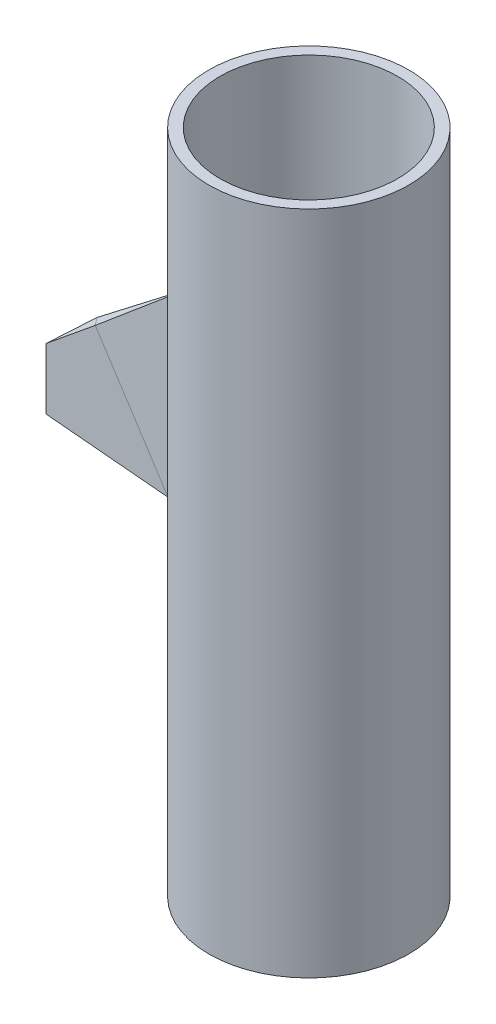
from build123d import *

# Parameters (mm, degrees)
SKETCH5_R           = 45
SKETCH5_R_2         = 40
BOSS_EXTRUDE6_DEPTH = 300
BOSS_EXTRUDE7_DEPTH = 5
SKETCH7_OUTSIDE_W   = 162.654
SKETCH7_OUTSIDE_H   = 372.654
CUT_EXTRUDE2_DEPTH  = 60
SKETCH8_OUTSIDE_W   = 236.044
SKETCH8_OUTSIDE_H   = 162.654
CUT_EXTRUDE4_DEPTH  = 63.333333
SKETCH9_R           = 2
CUT_EXTRUDE5_DEPTH  = 10


with BuildPart() as part:
    # Sketch5 → Boss-Extrude6 (new body)
    with BuildSketch(Plane(origin=(0, 0, 0), x_dir=(1, 0, 0), z_dir=(0, 1, 0))):
        with Locations(Location((0, 0, 0), (0, 0, 270))):
            Circle(SKETCH5_R)
        with Locations(Location((0, 0, 0), (0, 0, 270))):
            Circle(SKETCH5_R_2, mode=Mode.SUBTRACT)
    extrude(amount=BOSS_EXTRUDE6_DEPTH)


with BuildPart() as body_2:
    # Sketch6 → Boss-Extrude7 (new, symmetric)
    with BuildSketch(Plane.XY):
        Polygon((-58.389869674, 209.010177568), (-58.389869674, 129.010177568), (-118.389869674, 129.010177568), (-118.389869674, 159.010177568), align=None)
    extrude(amount=BOSS_EXTRUDE7_DEPTH, both=True)

    # Sketch7 outside → Cut-Extrude2 (cut)
    with BuildSketch(Plane(origin=(-58.389869674, 0, 0), x_dir=(0, 0, -1), z_dir=(1, 0, 0))):
        with Locations((0, 150)):
            Rectangle(SKETCH7_OUTSIDE_W, SKETCH7_OUTSIDE_H)
        Polygon((-5, 129.010177568), (0, 209.010177568), (5, 129.010177568), align=None, mode=Mode.SUBTRACT)
    extrude(amount=-CUT_EXTRUDE2_DEPTH, mode=Mode.SUBTRACT)

    # Sketch8 outside → Cut-Extrude4 (cut)
    with BuildSketch(Plane.XZ.offset(-129.010177568)):
        with Locations((-36.695, 0)):
            Rectangle(SKETCH8_OUTSIDE_W, SKETCH8_OUTSIDE_H)
        Polygon((-58.389869674, 5), (-118.389869674, 0), (-58.389869674, -5), align=None, mode=Mode.SUBTRACT)
    extrude(amount=-CUT_EXTRUDE4_DEPTH, mode=Mode.SUBTRACT)

    # Chamfer1
    # the kernel refuses this chamfer: 2 mm, written as the material it takes off along each edge
    with BuildSketch(Plane(origin=(-54.61893677, 212.152621655, 0.196402755), x_dir=(0.6406678172597216, -0.7640577696348805, -0.07589777722855967), z_dir=(-0.7676070857324205, -0.6396725714436841, -0.03997953571523024))) as chamfer1_piece_1:
        with BuildLine():
            Line((1.965032879, 0), (-0.204239114, 1.954390084))
            Line((-0.204239114, 1.954390084), (-0.244123554, 1.951351743))
            ThreePointArc((-0.244123554, 1.951351743), (-0.114485472, 0.976253024), (-0.039884439, -0.00303834))
            Line((-0.039884439, -0.00303834), (0.001123574, -0.039984217))
            ThreePointArc((0.001123574, -0.039984217), (0.982864796, -0.01239685), (1.966156453, -0.039984217))
            Line((1.966156453, -0.039984217), (1.965032879, 0))
        make_face()
    extrude(amount=57.926696558, mode=Mode.SUBTRACT)
    with BuildSketch(Plane(origin=(-99.083879501, 175.098502712, 2.119479678), x_dir=(-0.04868338001269826, -0.004005333382546194, -0.9988062303645456), z_dir=(0.7676070857324205, 0.6396725714436841, -0.03997953571523024))) as chamfer1_piece_2:
        with BuildLine():
            Line((1.965032879, 0), (-0.204239114, -1.954390084))
            Line((-0.204239114, -1.954390084), (-0.244123554, -1.951351743))
            ThreePointArc((-0.244123554, -1.951351743), (-0.114485472, -0.976253024), (-0.039884439, 0.00303834))
            Line((-0.039884439, 0.00303834), (0.001123574, 0.039984217))
            ThreePointArc((0.001123574, 0.039984217), (0.982864796, 0.01239685), (1.966156453, 0.039984217))
            Line((1.966156453, 0.039984217), (1.965032879, 0))
        make_face()
    extrude(amount=57.926696558, mode=Mode.SUBTRACT)
    with BuildSketch(Plane(origin=(-122.137227268, 155.887379573, 0.3122798), x_dir=(0.6340793876319524, -0.7690043228353277, -0.08109057676985179), z_dir=(0.7666518779999277, 0.63887656499994, -0.06388765649999398)), Plane(origin=(-91.565589003, 181.363744794, 2.235356723), x_dir=(0.6340793876319524, -0.7690043228353278, 0.0810905767698521), z_dir=(-0.7666518779999277, -0.63887656499994, -0.06388765649999398))) as chamfer1_piece_3:
        with BuildLine():
            Line((1.955180807, 0), (-0.213670596, -1.943470315))
            Line((-0.213670596, -1.943470315), (-0.253538324, -1.940220052))
            ThreePointArc((-0.253538324, -1.940220052), (-0.119271891, -0.97072125), (-0.039867729, 0.003250263))
            Line((-0.039867729, 0.003250263), (0.001126122, 0.039984145))
            ThreePointArc((0.001126122, 0.039984145), (0.977941693, 0.012472909), (1.956306929, 0.039984145))
            Line((1.956306929, 0.039984145), (1.955180807, 0))
        make_face()
    extrude(amount=39.876819118, mode=Mode.SUBTRACT)

    # Sketch9 → Cut-Extrude5 (cut)
    with BuildSketch(Plane(origin=(-58.389869674, 0, 0), x_dir=(0, 0, -1), z_dir=(1, 0, 0))):
        with Locations(Location((0, 162.229328702, 0), (0, 0, 90))):
            Circle(SKETCH9_R)
    extrude(amount=-CUT_EXTRUDE5_DEPTH, mode=Mode.SUBTRACT)


solid = Compound([part.part, body_2.part])
